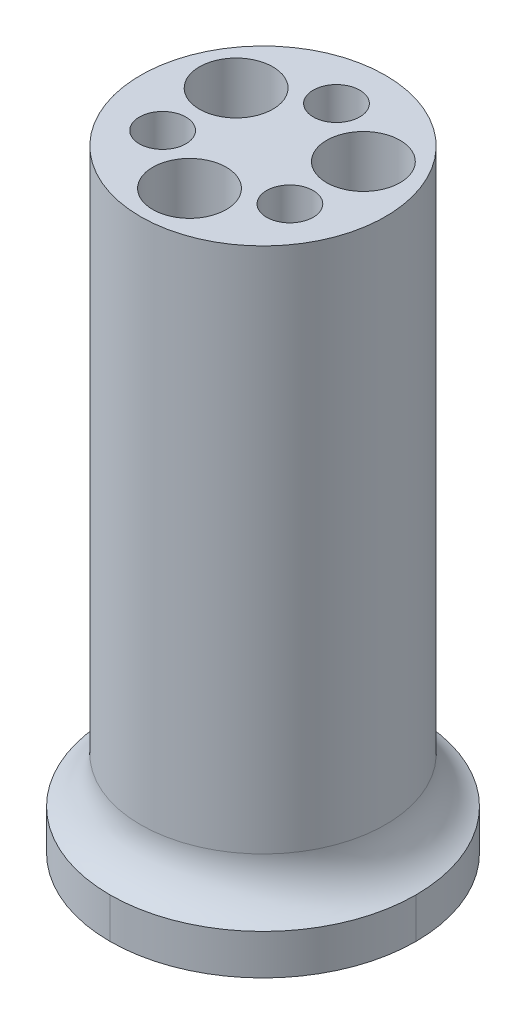
from build123d import *

# Parameters (mm, degrees)
SKETCH_1_R          = 10
EXTRUDE_1_DEPTH     = 30
SKETCH_2_R          = 1.85
CUT_EXTRUDE_1_DEPTH = 34.166247904
SKETCH_3_R          = 1.85
SKETCH_3_R_2        = 1.6
EXTRUDE_2_DEPTH     = 15
CUT_EXTRUDE_START   = -15
SKETCH_4_R          = 2.5
SKETCH_4_R_2        = 1.85
CUT_EXTRUDE_2_DEPTH = 15
EXTRUDE_START       = -15
SKETCH_5_R          = 1.85
SKETCH_5_R_2        = 1.6
EXTRUDE_3_DEPTH     = 15
SKETCH_6_R          = 2.5
CUT_EXTRUDE_4_DEPTH = 15
SKETCH_8_W          = 25
SKETCH_8_H          = 25
SKETCH_8_R          = 10
EXTRUDE_4_DEPTH     = 3
FILLET_1_R          = 4
FILLET_6_R          = 12.5
FILLET_7_R          = 12.5
FILLET_8_R          = 12.5
FILLET_9_R          = 12.5
EXTRUDE_START_2     = -25
SKETCH_9_R          = 2.5
EXTRUDE_6_DEPTH     = 25
SKETCH_10_R         = 1.9
CUT_EXTRUDE_5_DEPTH = 10
SKETCH_11_R         = 3
CUT_EXTRUDE_6_DEPTH = 15
EXTRUDE_START_3     = 20
SKETCH_13_R         = 10
SKETCH_13_R_2       = 3
SKETCH_13_R_3       = 1.9
EXTRUDE_7_DEPTH     = 20


# Some blends are built 0.0001 mm under size
with BuildPart() as part:
    # 草图1 → 凸台-拉伸1 (new body)
    with BuildSketch(Plane(origin=(0, 0, 0), x_dir=(1, 0, 0), z_dir=(0, 1, 0))):
        with Locations(Location((0, 0, 0), (0, 0, 270))):
            Circle(SKETCH_1_R)
    extrude(amount=EXTRUDE_1_DEPTH)

    # 草图2 → 切除-拉伸1 (cut, through all)
    with BuildSketch(Plane(origin=(0, 30, 0), x_dir=(1, 0, 0), z_dir=(0, 1, 0))):
        with Locations(Location((0, 6, 0), (0, 0, 270))):
            Circle(SKETCH_2_R)
        with Locations(Location((5.196152423, 3, 0), (0, 0, 270))):
            Circle(SKETCH_2_R)
        with Locations(Location((5.196152423, -3, 0), (0, 0, 270))):
            Circle(SKETCH_2_R)
        with Locations(Location((0, -6, 0), (0, 0, 270))):
            Circle(SKETCH_2_R)
        with Locations(Location((-5.196152423, -3, 0), (0, 0, 270))):
            Circle(SKETCH_2_R)
        with Locations(Location((-5.196152423, 3, 0), (0, 0, 270))):
            Circle(SKETCH_2_R)
    extrude(amount=-CUT_EXTRUDE_1_DEPTH, mode=Mode.SUBTRACT)

    # 草图3 → 凸台-拉伸2 (add)
    # profile 1 of 3: a face of its own
    with BuildSketch(Plane(origin=(0, 30, 0), x_dir=(1, 0, 0), z_dir=(0, 1, 0))):
        with Locations(Location((0, 6, 0), (0, 0, 270))):
            Circle(SKETCH_3_R)
        with Locations(Location((0, 6, 0), (0, 0, 270))):
            Circle(SKETCH_3_R_2, mode=Mode.SUBTRACT)
    # profile 2 of 3: a face of its own
    with BuildSketch(Plane(origin=(0, 30, 0), x_dir=(1, 0, 0), z_dir=(0, 1, 0))):
        with Locations(Location((-5.196152423, -3, 0), (0, 0, 270))):
            Circle(SKETCH_3_R)
        with Locations(Location((-5.196152423, -3, 0), (0, 0, 270))):
            Circle(SKETCH_3_R_2, mode=Mode.SUBTRACT)
    # profile 3 of 3: a face of its own
    with BuildSketch(Plane(origin=(0, 30, 0), x_dir=(1, 0, 0), z_dir=(0, 1, 0))):
        with Locations(Location((5.196152423, -3, 0), (0, 0, 270))):
            Circle(SKETCH_3_R)
        with Locations(Location((5.196152423, -3, 0), (0, 0, 270))):
            Circle(SKETCH_3_R_2, mode=Mode.SUBTRACT)
    extrude(amount=-EXTRUDE_2_DEPTH)

    # 草图4 → 切除-拉伸2 (cut)
    # profile 1 of 3: a face of its own
    with BuildSketch(Plane.XZ.offset(CUT_EXTRUDE_START)):
        with Locations(Location((-5.196152423, 3, 0), (0, 0, 270))):
            Circle(SKETCH_4_R)
        with Locations((-5.196152423, 3)):
            Circle(SKETCH_4_R_2, mode=Mode.SUBTRACT)
    # profile 2 of 3: a face of its own
    with BuildSketch(Plane.XZ.offset(CUT_EXTRUDE_START)):
        with Locations(Location((5.196152423, 3, 0), (0, 0, 270))):
            Circle(SKETCH_4_R)
        with Locations((5.196152423, 3)):
            Circle(SKETCH_4_R_2, mode=Mode.SUBTRACT)
    # profile 3 of 3: a face of its own
    with BuildSketch(Plane.XZ.offset(CUT_EXTRUDE_START)):
        with Locations(Location((0, -6, 0), (0, 0, 270))):
            Circle(SKETCH_4_R)
        with Locations((0, -6)):
            Circle(SKETCH_4_R_2, mode=Mode.SUBTRACT)
    extrude(amount=CUT_EXTRUDE_2_DEPTH, mode=Mode.SUBTRACT)

    # 草图5 → 凸台-拉伸3 (add)
    # profile 1 of 3: a face of its own
    with BuildSketch(Plane.XZ.offset(EXTRUDE_START)):
        with Locations(Location((0, 6, 0), (0, 0, 90))):
            Circle(SKETCH_5_R)
        with Locations(Location((0, 6, 0), (0, 0, 270))):
            Circle(SKETCH_5_R_2, mode=Mode.SUBTRACT)
    # profile 2 of 3: a face of its own
    with BuildSketch(Plane.XZ.offset(EXTRUDE_START)):
        with Locations(Location((-5.196152423, -3, 0), (0, 0, 90))):
            Circle(SKETCH_5_R)
        with Locations(Location((-5.196152423, -3, 0), (0, 0, 270))):
            Circle(SKETCH_5_R_2, mode=Mode.SUBTRACT)
    # profile 3 of 3: a face of its own
    with BuildSketch(Plane.XZ.offset(EXTRUDE_START)):
        with Locations(Location((5.196152423, -3, 0), (0, 0, 90))):
            Circle(SKETCH_5_R)
        with Locations(Location((5.196152423, -3, 0), (0, 0, 270))):
            Circle(SKETCH_5_R_2, mode=Mode.SUBTRACT)
    extrude(amount=EXTRUDE_3_DEPTH)

    # 草图6 → 切除-拉伸4 (cut)
    with BuildSketch(Plane(origin=(0, 30, 0), x_dir=(1, 0, 0), z_dir=(0, 1, 0))):
        with Locations(Location((-5.196152423, 3, 0), (0, 0, 270))):
            Circle(SKETCH_6_R)
        with Locations(Location((5.196152423, 3, 0), (0, 0, 270))):
            Circle(SKETCH_6_R)
        with Locations(Location((0, -6, 0), (0, 0, 270))):
            Circle(SKETCH_6_R)
    extrude(amount=-CUT_EXTRUDE_4_DEPTH, mode=Mode.SUBTRACT)

    # 草图8 → 凸台-拉伸4 (add)
    with BuildSketch(Plane.XZ):
        Rectangle(SKETCH_8_W, SKETCH_8_H)
        with Locations(Location((0, 0, 0), (0, 0, 270))):
            Circle(SKETCH_8_R, mode=Mode.SUBTRACT)
    extrude(amount=-EXTRUDE_4_DEPTH)

    # 圆角1
    # the kernel refuses this fillet: 4 mm, written as the material it adds along each edge
    with BuildSketch(Plane(origin=(0, 3, 0), x_dir=(0, 0, 1), z_dir=(-1, 0, 0))) as fillet_1_piece_1_section:
        with BuildLine():
            CenterArc((10 + FILLET_1_R, FILLET_1_R), FILLET_1_R, 180, 90)
            Line((10 + FILLET_1_R, 0), (10, 0))
            Line((10, 0), (10, FILLET_1_R))
        make_face()
    fillet_1_piece_1 = revolve(axis=Axis((0, 3, 0), (0, 1, 0)), mode=Mode.PRIVATE)
    fillet_1_piece_1 = split(fillet_1_piece_1, bisect_by=Plane(origin=(-12.5, 4.125745955, -11.125745955), z_dir=(1, 0, 0)), keep=Keep.TOP, mode=Mode.PRIVATE)
    fillet_1_piece_1 = split(fillet_1_piece_1, bisect_by=Plane(origin=(0, 4.125745955, 12.5), z_dir=(0, 0, -1)), keep=Keep.TOP, mode=Mode.PRIVATE)
    fillet_1_piece_1 = split(fillet_1_piece_1, bisect_by=Plane(origin=(12.5, 4.125745955, -11.125745955), z_dir=(-1, 0, 0)), keep=Keep.TOP, mode=Mode.PRIVATE)
    fillet_1_piece_1 = split(fillet_1_piece_1, bisect_by=Plane(origin=(0, 4.125745955, -12.5), z_dir=(0, 0, 1)), keep=Keep.TOP, mode=Mode.PRIVATE)
    add(fillet_1_piece_1)

    # 圆角6
    fillet_6_edges = [part.edges().sort_by_distance(p)[0] for p in [
        (12.5, 1.5, 12.5),
    ]]
    fillet(fillet_6_edges, radius=FILLET_6_R)

    # 圆角7
    fillet_7_edges = [part.edges().sort_by_distance(p)[0] for p in [
        (-12.5, 1.5, 12.5),
    ]]
    fillet(fillet_7_edges, radius=FILLET_7_R - 0.0001)  # a hair under: the kernel refuses the full size

    # 圆角8
    fillet_8_edges = [part.edges().sort_by_distance(p)[0] for p in [
        (-12.5, 1.5, -12.5),
    ]]
    fillet(fillet_8_edges, radius=FILLET_8_R)

    # 圆角9
    fillet_9_edges = [part.edges().sort_by_distance(p)[0] for p in [
        (12.5, 1.5, -12.5),
    ]]
    fillet(fillet_9_edges, radius=FILLET_9_R - 0.0001)  # a hair under: the kernel refuses the full size

    # 草图9 → 凸台-拉伸6 (add)
    with BuildSketch(Plane.XZ.offset(EXTRUDE_START_2)):
        with Locations((5.196152423, 3)):
            Circle(SKETCH_9_R)
        with Locations((-5.196152423, 3)):
            Circle(SKETCH_9_R)
        with Locations((0, -6)):
            Circle(SKETCH_9_R)
    extrude(amount=EXTRUDE_6_DEPTH)

    # 草图10 → 切除-拉伸5 (cut)
    with BuildSketch(Plane(origin=(0, 30, 0), x_dir=(1, 0, 0), z_dir=(0, 1, 0))):
        with Locations(Location((0, 6, 0), (0, 0, 270))):
            Circle(SKETCH_10_R)
        with Locations(Location((-5.196152423, -3, 0), (0, 0, 270))):
            Circle(SKETCH_10_R)
        with Locations(Location((5.196152423, -3, 0), (0, 0, 270))):
            Circle(SKETCH_10_R)
    extrude(amount=-CUT_EXTRUDE_5_DEPTH, mode=Mode.SUBTRACT)

    # 草图11 → 切除-拉伸6 (cut)
    with BuildSketch(Plane(origin=(0, 30, 0), x_dir=(1, 0, 0), z_dir=(0, 1, 0))):
        with Locations(Location((-5.196152423, 3, 0), (0, 0, 270))):
            Circle(SKETCH_11_R)
        with Locations(Location((5.196152423, 3, 0), (0, 0, 270))):
            Circle(SKETCH_11_R)
        with Locations(Location((0, -6, 0), (0, 0, 270))):
            Circle(SKETCH_11_R)
    extrude(amount=-CUT_EXTRUDE_6_DEPTH, mode=Mode.SUBTRACT)

    # 草图13 → 凸台-拉伸7 (add)
    with BuildSketch(Plane(origin=(0, 30, 0), x_dir=(1, 0, 0), z_dir=(0, 1, 0)).offset(EXTRUDE_START_3)):
        with Locations(Location((0, 0, 0), (0, 0, 270))):
            Circle(SKETCH_13_R)
        with Locations(Location((-5.196152423, 3, 0), (0, 0, 270))):
            Circle(SKETCH_13_R_2, mode=Mode.SUBTRACT)
        with Locations(Location((0, 6, 0), (0, 0, 270))):
            Circle(SKETCH_13_R_3, mode=Mode.SUBTRACT)
        with Locations(Location((5.196152423, 3, 0), (0, 0, 270))):
            Circle(SKETCH_13_R_2, mode=Mode.SUBTRACT)
        with Locations(Location((0, -6, 0), (0, 0, 270))):
            Circle(SKETCH_13_R_2, mode=Mode.SUBTRACT)
        with Locations(Location((5.196152423, -3, 0), (0, 0, 270))):
            Circle(SKETCH_13_R_3, mode=Mode.SUBTRACT)
        with Locations(Location((-5.196152423, -3, 0), (0, 0, 270))):
            Circle(SKETCH_13_R_3, mode=Mode.SUBTRACT)
    extrude(amount=-EXTRUDE_7_DEPTH)


solid = part.part
